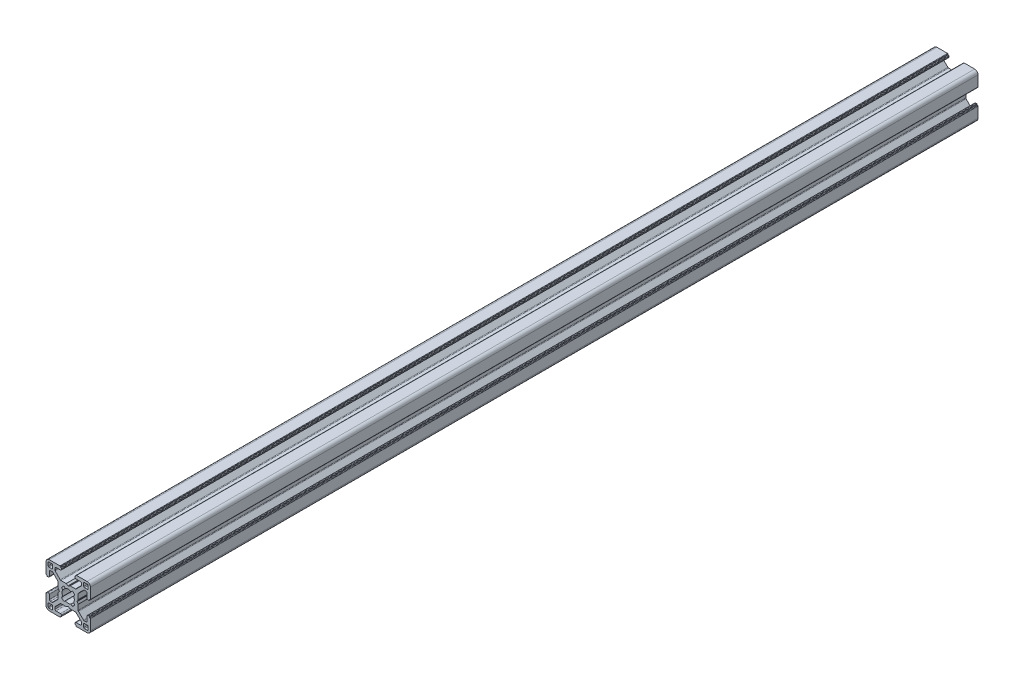
from build123d import *

# Parameters (mm, degrees)
ESTRUSIONE_ESTRUSIONE1_DEPTH = 400


with BuildPart() as part:
    # Schizzo1 → Estrusione-Estrusione1 (new body)
    with BuildSketch(Plane.XY.offset(100)):
        with BuildLine():
            Line((-9.299999732, 3), (-8.999999732, 3))
            ThreePointArc((-8.999999732, 3), (-8.646446341, 3.146446609), (-8.499999732, 3.5))
            Line((-8.499999732, 3.5), (-8.499999732, 5.499999605))
            ThreePointArc((-8.499999732, 5.499999605), (-8.353553123, 5.853552995), (-7.999999732, 5.999999605))
            Line((-7.999999732, 5.999999605), (-7.267766685, 5.999999605))
            ThreePointArc((-7.267766685, 5.999999605), (-7.076424969, 5.961939371), (-6.914213294, 5.853552995))
            Line((-6.914213294, 5.853552995), (-4.646446398, 3.585786099))
            ThreePointArc((-4.646446398, 3.585786099), (-4.538060023, 3.423574425), (-4.499999789, 3.232232708))
            Line((-4.499999789, 3.232232708), (-4.499999789, 0.953589302))
            ThreePointArc((-4.499999789, 0.953589302), (-4.493184953, 0.90182549), (-4.473204867, 0.853589297))
            Line((-4.473204867, 0.853589297), (-4.038119841, 0.099999969))
            ThreePointArc((-4.038119841, 0.099999969), (-4.011324929, 0), (-4.038119841, -0.099999969))
            Line((-4.038119841, -0.099999969), (-4.473204867, -0.853589297))
            ThreePointArc((-4.473204867, -0.853589297), (-4.493184953, -0.90182549), (-4.499999789, -0.953589302))
            Line((-4.499999789, -0.953589302), (-4.499999789, -3.232232708))
            ThreePointArc((-4.499999789, -3.232232708), (-4.538060023, -3.423574425), (-4.646446398, -3.585786099))
            Line((-4.646446398, -3.585786099), (-6.914213294, -5.853552995))
            ThreePointArc((-6.914213294, -5.853552995), (-7.076424969, -5.961939371), (-7.267766685, -5.999999605))
            Line((-7.267766685, -5.999999605), (-7.999999732, -5.999999605))
            ThreePointArc((-7.999999732, -5.999999605), (-8.353553123, -5.853552995), (-8.499999732, -5.499999605))
            Line((-8.499999732, -5.499999605), (-8.499999732, -3.5))
            ThreePointArc((-8.499999732, -3.5), (-8.646446341, -3.146446609), (-8.999999732, -3))
            Line((-8.999999732, -3), (-9.299999732, -3))
            ThreePointArc((-9.299999732, -3), (-9.441421088, -3.058578644), (-9.499999732, -3.2))
            Line((-9.499999732, -3.2), (-9.499999732, -3.349999605))
            ThreePointArc((-9.499999732, -3.349999605), (-9.558578376, -3.491420961), (-9.699999732, -3.549999605))
            Line((-9.699999732, -3.549999605), (-9.8, -3.549999605))
            ThreePointArc((-9.8, -3.549999605), (-9.941421356, -3.608578248), (-10, -3.749999605))
            Line((-10, -3.749999605), (-10, -8.5))
            ThreePointArc((-10, -8.5), (-9.560660172, -9.560660172), (-8.5, -10))
            Line((-8.5, -10), (-3.750000228, -10))
            ThreePointArc((-3.750000228, -10), (-3.608578871, -9.941421356), (-3.550000228, -9.8))
            Line((-3.550000228, -9.8), (-3.550000228, -9.7))
            ThreePointArc((-3.550000228, -9.7), (-3.491421584, -9.558578644), (-3.350000228, -9.5))
            Line((-3.350000228, -9.5), (-3.2, -9.5))
            ThreePointArc((-3.2, -9.5), (-3.058578644, -9.441421356), (-3, -9.3))
            Line((-3, -9.3), (-3, -8.999999673))
            ThreePointArc((-3, -8.999999673), (-3.146446609, -8.646446283), (-3.5, -8.499999673))
            Line((-3.5, -8.499999673), (-5.500000686, -8.499999673))
            ThreePointArc((-5.500000686, -8.499999673), (-5.853554077, -8.353553064), (-6.000000686, -7.999999673))
            Line((-6.000000686, -7.999999673), (-6.000000686, -7.267766626))
            ThreePointArc((-6.000000686, -7.267766626), (-5.961940448, -7.076424899), (-5.853554059, -6.914213219))
            Line((-5.853554059, -6.914213219), (-3.585787212, -4.646446592))
            ThreePointArc((-3.585787212, -4.646446592), (-3.423575544, -4.538060229), (-3.232233839, -4.5))
            Line((-3.232233839, -4.5), (-0.953590312, -4.5))
            ThreePointArc((-0.953590312, -4.5), (-0.901826505, -4.493185166), (-0.853590316, -4.473205083))
            Line((-0.853590316, -4.473205083), (-0.100000045, -4.038119562))
            ThreePointArc((-0.100000045, -4.038119562), (0, -4.011324632), (0.100000045, -4.038119562))
            Line((0.100000045, -4.038119562), (0.853590316, -4.473205083))
            ThreePointArc((0.853590316, -4.473205083), (0.901826505, -4.493185166), (0.953590312, -4.5))
            Line((0.953590312, -4.5), (3.23223292, -4.5))
            ThreePointArc((3.23223292, -4.5), (3.423574636, -4.538060234), (3.58578631, -4.646446609))
            Line((3.58578631, -4.646446609), (5.853554077, -6.914214376))
            ThreePointArc((5.853554077, -6.914214376), (5.961940452, -7.07642605), (6.000000686, -7.267767766))
            Line((6.000000686, -7.267767766), (6.000000686, -7.999999673))
            ThreePointArc((6.000000686, -7.999999673), (5.853554077, -8.353553064), (5.500000686, -8.499999673))
            Line((5.500000686, -8.499999673), (3.5, -8.499999673))
            ThreePointArc((3.5, -8.499999673), (3.146446609, -8.646446283), (3, -8.999999673))
            Line((3, -8.999999673), (3, -9.3))
            ThreePointArc((3, -9.3), (3.058578644, -9.441421356), (3.2, -9.5))
            Line((3.2, -9.5), (3.350000228, -9.5))
            ThreePointArc((3.350000228, -9.5), (3.491421584, -9.558578644), (3.550000228, -9.7))
            Line((3.550000228, -9.7), (3.550000228, -9.8))
            ThreePointArc((3.550000228, -9.8), (3.608578871, -9.941421356), (3.750000228, -10))
            Line((3.750000228, -10), (8.5, -10))
            ThreePointArc((8.5, -10), (9.560660172, -9.560660172), (10, -8.5))
            Line((10, -8.5), (10, -3.749999605))
            ThreePointArc((10, -3.749999605), (9.941421356, -3.608578248), (9.8, -3.549999605))
            Line((9.8, -3.549999605), (9.699999732, -3.549999605))
            ThreePointArc((9.699999732, -3.549999605), (9.558578376, -3.491420961), (9.499999732, -3.349999605))
            Line((9.499999732, -3.349999605), (9.499999732, -3.2))
            ThreePointArc((9.499999732, -3.2), (9.441421088, -3.058578644), (9.299999732, -3))
            Line((9.299999732, -3), (8.999999732, -3))
            ThreePointArc((8.999999732, -3), (8.646446341, -3.146446609), (8.499999732, -3.5))
            Line((8.499999732, -3.5), (8.499999732, -5.499999605))
            ThreePointArc((8.499999732, -5.499999605), (8.353553123, -5.853552995), (7.999999732, -5.999999605))
            Line((7.999999732, -5.999999605), (7.267766789, -5.999999605))
            ThreePointArc((7.267766789, -5.999999605), (7.076425084, -5.961939376), (6.914213416, -5.853553012))
            Line((6.914213416, -5.853553012), (4.646446415, -3.585786233))
            ThreePointArc((4.646446415, -3.585786233), (4.538060027, -3.423574553), (4.499999789, -3.232232825))
            Line((4.499999789, -3.232232825), (4.499999789, -0.953589302))
            ThreePointArc((4.499999789, -0.953589302), (4.493184953, -0.90182549), (4.473204867, -0.853589297))
            Line((4.473204867, -0.853589297), (4.038119841, -0.099999969))
            ThreePointArc((4.038119841, -0.099999969), (4.011324929, 0), (4.038119841, 0.099999969))
            Line((4.038119841, 0.099999969), (4.473204867, 0.853589297))
            ThreePointArc((4.473204867, 0.853589297), (4.493184953, 0.90182549), (4.499999789, 0.953589302))
            Line((4.499999789, 0.953589302), (4.499999789, 3.232232825))
            ThreePointArc((4.499999789, 3.232232825), (4.538060027, 3.423574553), (4.646446415, 3.585786233))
            Line((4.646446415, 3.585786233), (6.914213416, 5.853553012))
            ThreePointArc((6.914213416, 5.853553012), (7.076425084, 5.961939376), (7.267766789, 5.999999605))
            Line((7.267766789, 5.999999605), (7.999999732, 5.999999605))
            ThreePointArc((7.999999732, 5.999999605), (8.353553123, 5.853552995), (8.499999732, 5.499999605))
            Line((8.499999732, 5.499999605), (8.499999732, 3.5))
            ThreePointArc((8.499999732, 3.5), (8.646446341, 3.146446609), (8.999999732, 3))
            Line((8.999999732, 3), (9.299999732, 3))
            ThreePointArc((9.299999732, 3), (9.441421088, 3.058578644), (9.499999732, 3.2))
            Line((9.499999732, 3.2), (9.499999732, 3.349999605))
            ThreePointArc((9.499999732, 3.349999605), (9.558578376, 3.491420961), (9.699999732, 3.549999605))
            Line((9.699999732, 3.549999605), (9.8, 3.549999605))
            ThreePointArc((9.8, 3.549999605), (9.941421356, 3.608578248), (10, 3.749999605))
            Line((10, 3.749999605), (10, 8.5))
            ThreePointArc((10, 8.5), (9.560660172, 9.560660172), (8.5, 10))
            Line((8.5, 10), (3.750000228, 10))
            ThreePointArc((3.750000228, 10), (3.608578871, 9.941421356), (3.550000228, 9.8))
            Line((3.550000228, 9.8), (3.550000228, 9.7))
            ThreePointArc((3.550000228, 9.7), (3.491421584, 9.558578644), (3.350000228, 9.5))
            Line((3.350000228, 9.5), (3.2, 9.5))
            ThreePointArc((3.2, 9.5), (3.058578644, 9.441421356), (3, 9.3))
            Line((3, 9.3), (3, 8.999999673))
            ThreePointArc((3, 8.999999673), (3.146446609, 8.646446283), (3.5, 8.499999673))
            Line((3.5, 8.499999673), (5.500000686, 8.499999673))
            ThreePointArc((5.500000686, 8.499999673), (5.853554077, 8.353553064), (6.000000686, 7.999999673))
            Line((6.000000686, 7.999999673), (6.000000686, 7.267767766))
            ThreePointArc((6.000000686, 7.267767766), (5.961940452, 7.07642605), (5.853554077, 6.914214376))
            Line((5.853554077, 6.914214376), (3.58578631, 4.646446609))
            ThreePointArc((3.58578631, 4.646446609), (3.423574636, 4.538060234), (3.23223292, 4.5))
            Line((3.23223292, 4.5), (0.953590312, 4.5))
            ThreePointArc((0.953590312, 4.5), (0.901826505, 4.493185166), (0.853590316, 4.473205083))
            Line((0.853590316, 4.473205083), (0.100000045, 4.038119562))
            ThreePointArc((0.100000045, 4.038119562), (0, 4.011324632), (-0.100000045, 4.038119562))
            Line((-0.100000045, 4.038119562), (-0.853590316, 4.473205083))
            ThreePointArc((-0.853590316, 4.473205083), (-0.901826505, 4.493185166), (-0.953590312, 4.5))
            Line((-0.953590312, 4.5), (-3.232233839, 4.5))
            ThreePointArc((-3.232233839, 4.5), (-3.423575544, 4.538060229), (-3.585787212, 4.646446592))
            Line((-3.585787212, 4.646446592), (-5.853554059, 6.914213219))
            ThreePointArc((-5.853554059, 6.914213219), (-5.961940448, 7.076424899), (-6.000000686, 7.267766626))
            Line((-6.000000686, 7.267766626), (-6.000000686, 7.999999673))
            ThreePointArc((-6.000000686, 7.999999673), (-5.853554077, 8.353553064), (-5.500000686, 8.499999673))
            Line((-5.500000686, 8.499999673), (-3.5, 8.499999673))
            ThreePointArc((-3.5, 8.499999673), (-3.146446609, 8.646446283), (-3, 8.999999673))
            Line((-3, 8.999999673), (-3, 9.3))
            ThreePointArc((-3, 9.3), (-3.058578644, 9.441421356), (-3.2, 9.5))
            Line((-3.2, 9.5), (-3.350000228, 9.5))
            ThreePointArc((-3.350000228, 9.5), (-3.491421584, 9.558578644), (-3.550000228, 9.7))
            Line((-3.550000228, 9.7), (-3.550000228, 9.8))
            ThreePointArc((-3.550000228, 9.8), (-3.608578871, 9.941421356), (-3.750000228, 10))
            Line((-3.750000228, 10), (-8.5, 10))
            ThreePointArc((-8.5, 10), (-9.560660172, 9.560660172), (-10, 8.5))
            Line((-10, 8.5), (-10, 3.749999605))
            ThreePointArc((-10, 3.749999605), (-9.941421356, 3.608578248), (-9.8, 3.549999605))
            Line((-9.8, 3.549999605), (-9.699999732, 3.549999605))
            ThreePointArc((-9.699999732, 3.549999605), (-9.558578376, 3.491420961), (-9.499999732, 3.349999605))
            Line((-9.499999732, 3.349999605), (-9.499999732, 3.2))
            ThreePointArc((-9.499999732, 3.2), (-9.441421088, 3.058578644), (-9.299999732, 3))
        make_face()
        with BuildLine():
            Line((-1.91389502, 2.989640962), (-1.258185436, 2.445295362))
            ThreePointArc((-1.258185436, 2.445295362), (0, 2.75), (1.258185436, 2.445295362))
            Line((1.258185436, 2.445295362), (1.91389502, 2.989640962))
            ThreePointArc((1.91389502, 2.989640962), (2.511737261, 2.508410485), (2.992174953, 1.909930962))
            Line((2.992174953, 1.909930962), (2.445295423, 1.258185317))
            ThreePointArc((2.445295423, 1.258185317), (2.75, 0), (2.445295423, -1.258185317))
            Line((2.445295423, -1.258185317), (2.992174953, -1.909930962))
            ThreePointArc((2.992174953, -1.909930962), (2.511737261, -2.508410485), (1.91389502, -2.989640962))
            Line((1.91389502, -2.989640962), (1.258185436, -2.445295362))
            ThreePointArc((1.258185436, -2.445295362), (0, -2.75), (-1.258185436, -2.445295362))
            Line((-1.258185436, -2.445295362), (-1.91389502, -2.989640962))
            ThreePointArc((-1.91389502, -2.989640962), (-2.511737261, -2.508410485), (-2.992174953, -1.909930962))
            Line((-2.992174953, -1.909930962), (-2.445295423, -1.258185317))
            ThreePointArc((-2.445295423, -1.258185317), (-2.75, 0), (-2.445295423, 1.258185317))
            Line((-2.445295423, 1.258185317), (-2.992174953, 1.909930962))
            ThreePointArc((-2.992174953, 1.909930962), (-2.511737261, 2.508410485), (-1.91389502, 2.989640962))
        make_face(mode=Mode.SUBTRACT)
        with BuildLine():
            Line((8.699999314, 7.000000686), (7.3, 7.000000686))
            ThreePointArc((7.3, 7.000000686), (7.087867966, 7.087868652), (7, 7.300000686))
            Line((7, 7.300000686), (7, 8.7))
            ThreePointArc((7, 8.7), (7.087867966, 8.912132034), (7.3, 9))
            Line((7.3, 9), (8.699999314, 9))
            ThreePointArc((8.699999314, 9), (8.912131348, 8.912132034), (8.999999314, 8.7))
            Line((8.999999314, 8.7), (8.999999314, 7.300000686))
            ThreePointArc((8.999999314, 7.300000686), (8.912131348, 7.087868652), (8.699999314, 7.000000686))
        make_face(mode=Mode.SUBTRACT)
        with BuildLine():
            Line((-7.300000686, 7.000000686), (-8.7, 7.000000686))
            ThreePointArc((-8.7, 7.000000686), (-8.912132034, 7.087868652), (-9, 7.300000686))
            Line((-9, 7.300000686), (-9, 8.7))
            ThreePointArc((-9, 8.7), (-8.912132034, 8.912132034), (-8.7, 9))
            Line((-8.7, 9), (-7.300000686, 9))
            ThreePointArc((-7.300000686, 9), (-7.087868652, 8.912132034), (-7.000000686, 8.7))
            Line((-7.000000686, 8.7), (-7.000000686, 7.300000686))
            ThreePointArc((-7.000000686, 7.300000686), (-7.087868652, 7.087868652), (-7.300000686, 7.000000686))
        make_face(mode=Mode.SUBTRACT)
        with BuildLine():
            Line((8.699999314, -8.999999314), (7.3, -8.999999314))
            ThreePointArc((7.3, -8.999999314), (7.087867966, -8.912131348), (7, -8.699999314))
            Line((7, -8.699999314), (7, -7.3))
            ThreePointArc((7, -7.3), (7.087867966, -7.087867966), (7.3, -7))
            Line((7.3, -7), (8.699999314, -7))
            ThreePointArc((8.699999314, -7), (8.912131348, -7.087867966), (8.999999314, -7.3))
            Line((8.999999314, -7.3), (8.999999314, -8.699999314))
            ThreePointArc((8.999999314, -8.699999314), (8.912131348, -8.912131348), (8.699999314, -8.999999314))
        make_face(mode=Mode.SUBTRACT)
        with BuildLine():
            Line((-7.300000686, -8.999999314), (-8.7, -8.999999314))
            ThreePointArc((-8.7, -8.999999314), (-8.912132034, -8.912131348), (-9, -8.699999314))
            Line((-9, -8.699999314), (-9, -7.3))
            ThreePointArc((-9, -7.3), (-8.912132034, -7.087867966), (-8.7, -7))
            Line((-8.7, -7), (-7.300000686, -7))
            ThreePointArc((-7.300000686, -7), (-7.087868652, -7.087867966), (-7.000000686, -7.3))
            Line((-7.000000686, -7.3), (-7.000000686, -8.699999314))
            ThreePointArc((-7.000000686, -8.699999314), (-7.087868652, -8.912131348), (-7.300000686, -8.999999314))
        make_face(mode=Mode.SUBTRACT)
    extrude(amount=-ESTRUSIONE_ESTRUSIONE1_DEPTH)


solid = part.part
